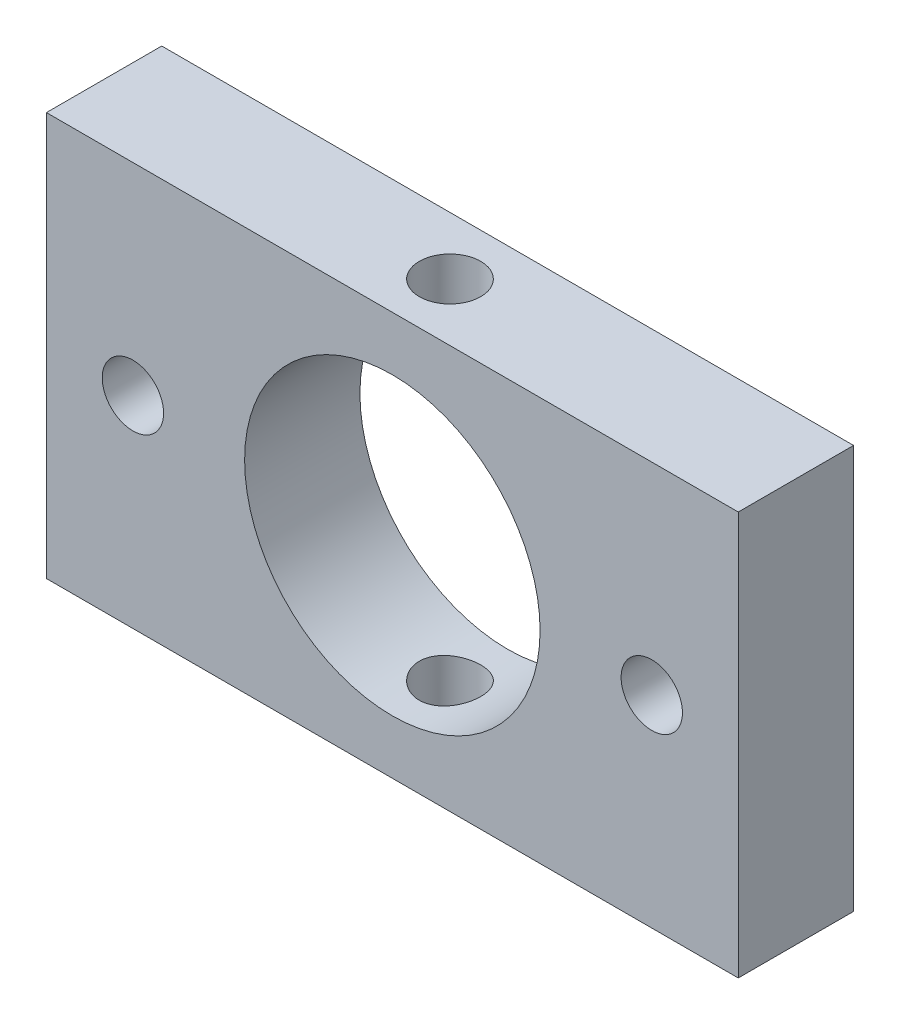
from build123d import *

# Parameters (mm, degrees)
SKETCH1_W                 = 76.2
SKETCH1_H                 = 44.45
BOSS_EXTRUDE1_DEPTH       = 12.7
F_1_1_4_CLEARANCE_HOLE1_D = 32.54248
F_1_4_CLEARANCE_HOLE1_D   = 6.7564
F_1_4_CLEARANCE_HOLE2_D   = 6.7564


with BuildPart() as part:
    # Sketch1 → Boss-Extrude1 (new body)
    with BuildSketch(Plane.XY):
        Rectangle(SKETCH1_W, SKETCH1_H)
    extrude(amount=BOSS_EXTRUDE1_DEPTH)

    # 1-1/4 Clearance Hole1 (through all)
    with Locations(Plane.XY.offset(12.7)):
        with Locations((0, 0)):
            Hole(F_1_1_4_CLEARANCE_HOLE1_D / 2)

    # 1/4 Clearance Hole1 (through all)
    with Locations(Plane.XY.offset(12.7)):
        with Locations((-28.575, 0), (28.575, 0)):
            Hole(F_1_4_CLEARANCE_HOLE1_D / 2)

    # 1/4 Clearance Hole2 (through all)
    with Locations(Plane(origin=(0, 22.225, 0), x_dir=(1, 0, 0), z_dir=(0, 1, 0))):
        with Locations((0, -6.35)):
            Hole(F_1_4_CLEARANCE_HOLE2_D / 2)


solid = part.part
